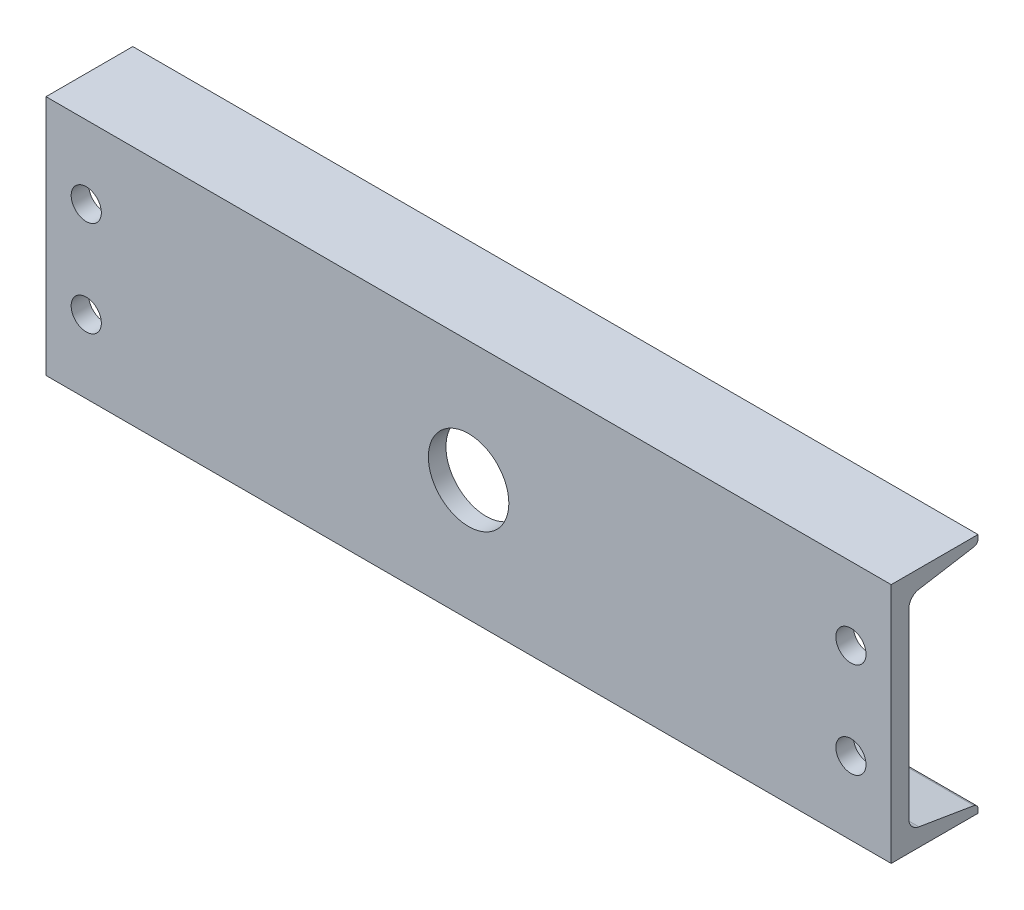
from build123d import *

# Parameters (mm, degrees)
BOSS_EXTRUDE1_DEPTH = 266.7
CUT_EXTRUDE1_REACH  = 284.731
SKETCH2_R           = 25.4
CUT_EXTRUDE2_REACH  = 284.731
SKETCH3_R           = 9.525


with BuildPart() as part:
    # Sketch1 → Boss-Extrude1 (new, symmetric)
    with BuildSketch(Plane(origin=(0, 0, 0), x_dir=(0, 0, -1), z_dir=(1, 0, 0))):
        with BuildLine():
            Line((-27.3939, -76.2), (-27.3939, 76.2))
            Line((-27.3939, 76.2), (27.3939, 76.2))
            Line((27.3939, 76.2), (27.3939, 73.710744653))
            ThreePointArc((27.3939, 73.710744653), (26.67159656, 71.740607726), (24.84702368, 70.704221901))
            Line((24.84702368, 70.704221901), (-9.926909199, 64.908143628))
            ThreePointArc((-9.926909199, 64.908143628), (-14.488341399, 62.317179067), (-16.2941, 57.391836749))
            Line((-16.2941, 57.391836749), (-16.2941, -57.391836749))
            ThreePointArc((-16.2941, -57.391836749), (-14.488341399, -62.317179067), (-9.926909199, -64.908143628))
            Line((-9.926909199, -64.908143628), (24.84702368, -70.704221901))
            ThreePointArc((24.84702368, -70.704221901), (26.67159656, -71.740607726), (27.3939, -73.710744653))
            Line((27.3939, -73.710744653), (27.3939, -76.2))
            Line((27.3939, -76.2), (-27.3939, -76.2))
        make_face()
    extrude(amount=BOSS_EXTRUDE1_DEPTH, both=True)

    # Sketch2 → Cut-Extrude1 (cut, up to next)
    with BuildSketch(Plane.XY.offset(27.3939), mode=Mode.PRIVATE) as cut_extrude1_sk1:
        Circle(SKETCH2_R)
    cut_extrude1_tool1 = extrude(cut_extrude1_sk1.sketch, amount=-CUT_EXTRUDE1_REACH, mode=Mode.PRIVATE) & part.part
    add(cut_extrude1_tool1.solids().sort_by_distance((0, 0, 27.3939))[0], mode=Mode.SUBTRACT)

    # Sketch3 → Cut-Extrude2 (cut, up to next)
    with BuildSketch(Plane.XY.offset(27.3939), mode=Mode.PRIVATE) as cut_extrude2_sk1:
        with Locations((-241.3, 30.1625)):
            Circle(SKETCH3_R)
    cut_extrude2_tool1 = extrude(cut_extrude2_sk1.sketch, amount=-CUT_EXTRUDE2_REACH, mode=Mode.PRIVATE) & part.part
    # Sketch3 → Cut-Extrude2 (cut, up to next)
    with BuildSketch(Plane.XY.offset(27.3939), mode=Mode.PRIVATE) as cut_extrude2_sk2:
        with Locations((241.3, 30.1625)):
            Circle(SKETCH3_R)
    cut_extrude2_tool2 = extrude(cut_extrude2_sk2.sketch, amount=-CUT_EXTRUDE2_REACH, mode=Mode.PRIVATE) & part.part
    # Sketch3 → Cut-Extrude2 (cut, up to next)
    with BuildSketch(Plane.XY.offset(27.3939), mode=Mode.PRIVATE) as cut_extrude2_sk3:
        with Locations((241.3, -30.1625)):
            Circle(SKETCH3_R)
    cut_extrude2_tool3 = extrude(cut_extrude2_sk3.sketch, amount=-CUT_EXTRUDE2_REACH, mode=Mode.PRIVATE) & part.part
    # Sketch3 → Cut-Extrude2 (cut, up to next)
    with BuildSketch(Plane.XY.offset(27.3939), mode=Mode.PRIVATE) as cut_extrude2_sk4:
        with Locations((-241.3, -30.1625)):
            Circle(SKETCH3_R)
    cut_extrude2_tool4 = extrude(cut_extrude2_sk4.sketch, amount=-CUT_EXTRUDE2_REACH, mode=Mode.PRIVATE) & part.part
    add(cut_extrude2_tool1.solids().sort_by_distance((-241.3, 30.1625, 27.3939))[0], mode=Mode.SUBTRACT)
    add(cut_extrude2_tool2.solids().sort_by_distance((241.3, 30.1625, 27.3939))[0], mode=Mode.SUBTRACT)
    add(cut_extrude2_tool3.solids().sort_by_distance((241.3, -30.1625, 27.3939))[0], mode=Mode.SUBTRACT)
    add(cut_extrude2_tool4.solids().sort_by_distance((-241.3, -30.1625, 27.3939))[0], mode=Mode.SUBTRACT)


solid = part.part
